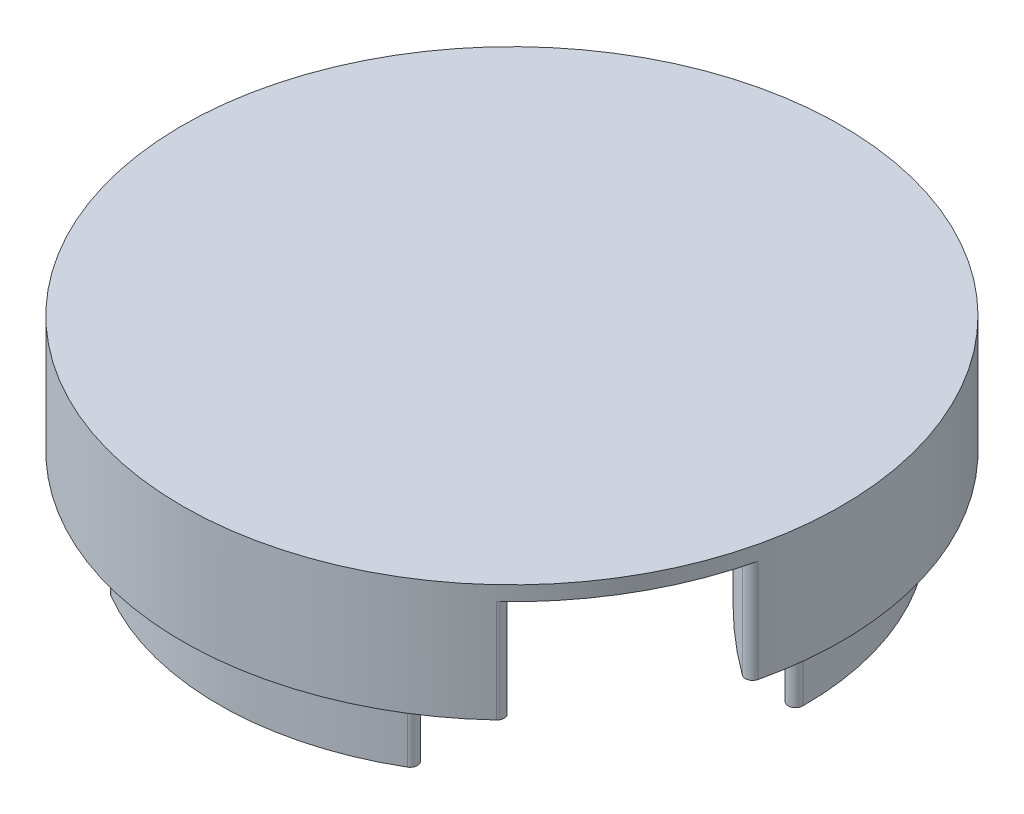
from build123d import *

# Parameters (mm, degrees)
SKETCH1_R                = 37.5
BOSS_EXTRUDE1_DEPTH      = 14
CUT_EXTRUDE2_START       = -14
CUT_EXTRUDE2_DEPTH       = 14
SKETCH4_R                = 45
SKETCH4_R_2              = 37.5
BOSS_EXTRUDE2_DEPTH      = 14
SKETCH6_R                = 45
BOSS_EXTRUDE3_DEPTH      = 2
SKETCH7_R                = 1.75
CUT_EXTRUDE3_DEPTH       = 66.620118866
CIRPATTERN2_COUNT        = 3
BOSS_EXTRUDE4_DEPTH      = 10
FILLET1_R                = 1
CIRPATTERN3_COUNT        = 3
FILLET1_OF_CIRPATTERN3_R = 1
CUT_EXTRUDE4_DEPTH       = 69.01470446
FILLET2_R                = 1
SKETCH15_R               = 45
BOSS_EXTRUDE5_DEPTH      = 2


# Read off the part's stored shape, not the designer's step: Cut-Extrude2
with BuildPart() as part:
    # Sketch1 → Boss-Extrude1 (new body)
    with BuildSketch(Plane(origin=(0, 0, 0), x_dir=(1, 0, 0), z_dir=(0, 1, 0))):
        with Locations(Location((0, 0, 0), (0, 0, 270))):
            Circle(SKETCH1_R)
    extrude(amount=BOSS_EXTRUDE1_DEPTH)

    # Cut-Extrude2 outline → Cut-Extrude2 (cut)
    with BuildSketch(Plane(origin=(0, 14, 0), x_dir=(1, 0, 0), z_dir=(0, 1, 0)).offset(CUT_EXTRUDE2_START)):
        with BuildLine():
            ThreePointArc((-24.104535363, -28.726666617), (0, -24.760936498), (24.104535363, -28.726666617))
            ThreePointArc((24.104535363, -28.726666617), (32.475952642, -18.75), (36.930290738, -6.511806663))
            ThreePointArc((36.930290738, -6.511806663), (21.443600029, 12.380468249), (12.825755375, 35.238473279))
            ThreePointArc((12.825755375, 35.238473279), (0, 37.5), (-12.825755375, 35.238473279))
            ThreePointArc((-12.825755375, 35.238473279), (-21.443600029, 12.380468249), (-36.930290738, -6.511806663))
            ThreePointArc((-36.930290738, -6.511806663), (-32.475952642, -18.75), (-24.104535363, -28.726666617))
        make_face()
    extrude(amount=CUT_EXTRUDE2_DEPTH, mode=Mode.SUBTRACT)

    # Sketch4 → Boss-Extrude2 (add)
    with BuildSketch(Plane(origin=(0, 0, 0), x_dir=(1, 0, 0), z_dir=(0, 1, 0))):
        with Locations(Location((0, 0, 0), (0, 0, 270))):
            Circle(SKETCH4_R)
        Circle(SKETCH4_R_2, mode=Mode.SUBTRACT)
    extrude(amount=BOSS_EXTRUDE2_DEPTH)

    # Sketch6 → Boss-Extrude3 (add)
    with BuildSketch(Plane(origin=(0, 14, 0), x_dir=(1, 0, 0), z_dir=(0, 1, 0))):
        with Locations(Location((0, 0, 0), (0, 0, 270))):
            Circle(SKETCH6_R)
        with BuildLine():
            ThreePointArc((-28.952849653, 1.653026611), (-25.11473671, -14.5), (-13.044861788, -25.900416617))
            ThreePointArc((-13.044861788, -25.900416617), (0, -24.760936498), (13.044861788, -25.900416617))
            ThreePointArc((13.044861788, -25.900416617), (25.11473671, -14.5), (28.952849653, 1.653026611))
            ThreePointArc((28.952849653, 1.653026611), (21.443600029, 12.380468249), (15.907987865, 24.247390006))
            ThreePointArc((15.907987865, 24.247390006), (0, 29), (-15.907987865, 24.247390006))
            ThreePointArc((-15.907987865, 24.247390006), (-21.443600029, 12.380468249), (-28.952849653, 1.653026611))
        make_face(mode=Mode.SUBTRACT)
    extrude(amount=BOSS_EXTRUDE3_DEPTH)

    # Sketch7 → Cut-Extrude3 (cut, through all)
    with BuildSketch(Plane(origin=(0, 16, 0), x_dir=(1, 0, 0), z_dir=(0, 1, 0))):
        with Locations(Location((0, 32, 0), (0, 0, 270))):
            Circle(SKETCH7_R)
    cut_extrude3 = extrude(amount=-CUT_EXTRUDE3_DEPTH, mode=Mode.SUBTRACT)

    # CirPattern2: Cut-Extrude3 ×3 about axis
    cirpattern2_axis = Axis((0, 0, 0), (0, 1, 0))
    for i in range(1, CIRPATTERN2_COUNT):
        add(cut_extrude3.rotate(cirpattern2_axis, i * 360 / CIRPATTERN2_COUNT), mode=Mode.SUBTRACT)

    # Sketch13 → Boss-Extrude4 (add)
    with BuildSketch(Plane.XZ):
        with BuildLine():
            ThreePointArc((-22.11228446, 33.332369792), (0, 29.760936498), (22.11228446, 33.332369792))
            ThreePointArc((22.11228446, 33.332369792), (0, 40), (-22.11228446, 33.332369792))
        make_face()
    boss_extrude4 = extrude(amount=BOSS_EXTRUDE4_DEPTH)

    # Fillet1
    fillet1_edges = [part.edges().sort_by_distance(p)[0] for p in [
        (22.11228446, -5, 33.332369792),
        (-22.11228446, -5, 33.332369792),
    ]]
    fillet(fillet1_edges, radius=FILLET1_R)

    # CirPattern3: Boss-Extrude4 ×3 about axis
    cirpattern3_axis = Axis((0, 0, 0), (0, 1, 0))
    for i in range(1, CIRPATTERN3_COUNT):
        add(boss_extrude4.rotate(cirpattern3_axis, i * 360 / CIRPATTERN3_COUNT))

    # Fillet1 of CirPattern3
    fillet1_of_cirpattern3_edges = [part.edges().sort_by_distance(p)[0] for p in [
        (17.810536778, -5, -35.815984974),
        (39.922821238, -5, 2.483615182),
        (-39.922821238, -5, 2.483615182),
        (-17.810536778, -5, -35.815984974),
    ]]
    fillet(fillet1_of_cirpattern3_edges, radius=FILLET1_OF_CIRPATTERN3_R)

    # Sketch14 → Cut-Extrude4 (cut, through all)
    with BuildSketch(Plane.XZ.offset(-14)):
        with BuildLine():
            Line((-33.206244265, 32.485097805), (-44.736042076, 12.514902195))
            ThreePointArc((-44.736042076, 12.514902195), (-21.443600029, -12.380468249), (-11.529797811, -45))
            Line((-11.529797811, -45), (11.529797811, -45))
            ThreePointArc((11.529797811, -45), (21.443600029, -12.380468249), (44.736042076, 12.514902195))
            Line((44.736042076, 12.514902195), (33.206244265, 32.485097805))
            ThreePointArc((33.206244265, 32.485097805), (0, 24.760936498), (-33.206244265, 32.485097805))
        make_face()
    extrude(amount=CUT_EXTRUDE4_DEPTH, mode=Mode.SUBTRACT)

    # Fillet2
    fillet2_edges = [part.edges().sort_by_distance(p)[0] for p in [
        (43.466885988, 7, 11.646021745),
        (11.64769231, 7, -43.466438362),
        (-31.819193678, 7, 31.820416617),
        (31.819193678, 7, 31.820416617),
        (-11.64769231, 7, -43.466438362),
        (-43.466885988, 7, 11.646021745),
    ]]
    fillet(fillet2_edges, radius=FILLET2_R)

    # Sketch15 → Boss-Extrude5 (add)
    with BuildSketch(Plane.XZ.offset(-14)):
        with Locations(Location((0, 0, 0), (0, 0, 253.108257002))):
            Circle(SKETCH15_R)
    extrude(amount=-BOSS_EXTRUDE5_DEPTH)


solid = part.part
